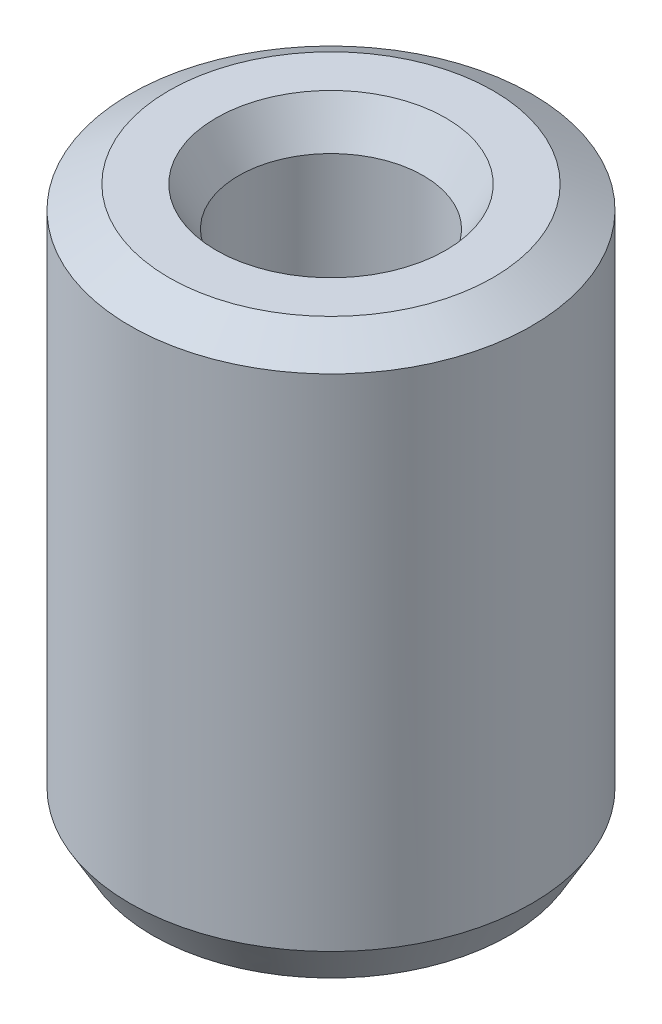
from build123d import *
from OCP.BRepFilletAPI import BRepFilletAPI_MakeChamfer

# Parameters (mm, degrees)
SKETCH1_R           = 20
BOSS_EXTRUDE1_DEPTH = 55.905876447
SKETCH2_R           = 9.195750127
CUT_EXTRUDE1_DEPTH  = 63.653547555
CHAMFER1_SIZE       = 2.230760434
CHAMFER1_SIZE2      = 3.863790412


with BuildPart() as part:
    # Sketch1 → Boss-Extrude1 (new body)
    with BuildSketch(Plane(origin=(0, 0, 0), x_dir=(1, 0, 0), z_dir=(0, 1, 0))):
        Circle(SKETCH1_R)
    extrude(amount=BOSS_EXTRUDE1_DEPTH)

    # Sketch2 → Cut-Extrude1 (cut, through all)
    with BuildSketch(Plane(origin=(0, 0, 0), x_dir=(1, 0, 0), z_dir=(0, 1, 0))):
        Circle(SKETCH2_R)
    extrude(amount=CUT_EXTRUDE1_DEPTH, mode=Mode.SUBTRACT)

    # Chamfer1: one chamfer whose edges measure the first distance from different faces: ONE call of the kernel's chamfer builder (chamfer() names one face for all edges)
    chamfer1_edges_1 = [part.edges().sort_by_distance(p)[0] for p in [
        (-9.195750127, 55.905876447, 0),
    ]]
    chamfer1_side_1 = [part.faces().sort_by_distance(p)[0] for p in [
        (-19.434314575, 55.905876447, 0),
    ]]
    chamfer1_edges_2 = [part.edges().sort_by_distance(p)[0] for p in [
        (-9.195750127, 0, 0),
    ]]
    chamfer1_side_2 = [part.faces().sort_by_distance(p)[0] for p in [
        (-9.195750127, 27.952938223, 0),
    ]]
    chamfer1_edges_3 = [part.edges().sort_by_distance(p)[0] for p in [
        (-20, 0, 0),
    ]]
    chamfer1_side_3 = [part.faces().sort_by_distance(p)[0] for p in [
        (-19.434314575, 0, 0),
    ]]
    chamfer1_edges_4 = [part.edges().sort_by_distance(p)[0] for p in [
        (-20, 55.905876447, 0),
    ]]
    chamfer1_side_4 = [part.faces().sort_by_distance(p)[0] for p in [
        (-20, 27.952938223, 0),
    ]]
    chamfer1 = BRepFilletAPI_MakeChamfer(part.part.solid().wrapped)
    for e in chamfer1_edges_1:
        chamfer1.Add(CHAMFER1_SIZE, CHAMFER1_SIZE2, e.wrapped, chamfer1_side_1[0].wrapped)  # the first distance lies on this face
    for e in chamfer1_edges_2:
        chamfer1.Add(CHAMFER1_SIZE, CHAMFER1_SIZE2, e.wrapped, chamfer1_side_2[0].wrapped)  # the first distance lies on this face
    for e in chamfer1_edges_3:
        chamfer1.Add(CHAMFER1_SIZE, CHAMFER1_SIZE2, e.wrapped, chamfer1_side_3[0].wrapped)  # the first distance lies on this face
    for e in chamfer1_edges_4:
        chamfer1.Add(CHAMFER1_SIZE, CHAMFER1_SIZE2, e.wrapped, chamfer1_side_4[0].wrapped)  # the first distance lies on this face
    add(Compound.cast(chamfer1.Shape()), mode=Mode.REPLACE)


solid = part.part
